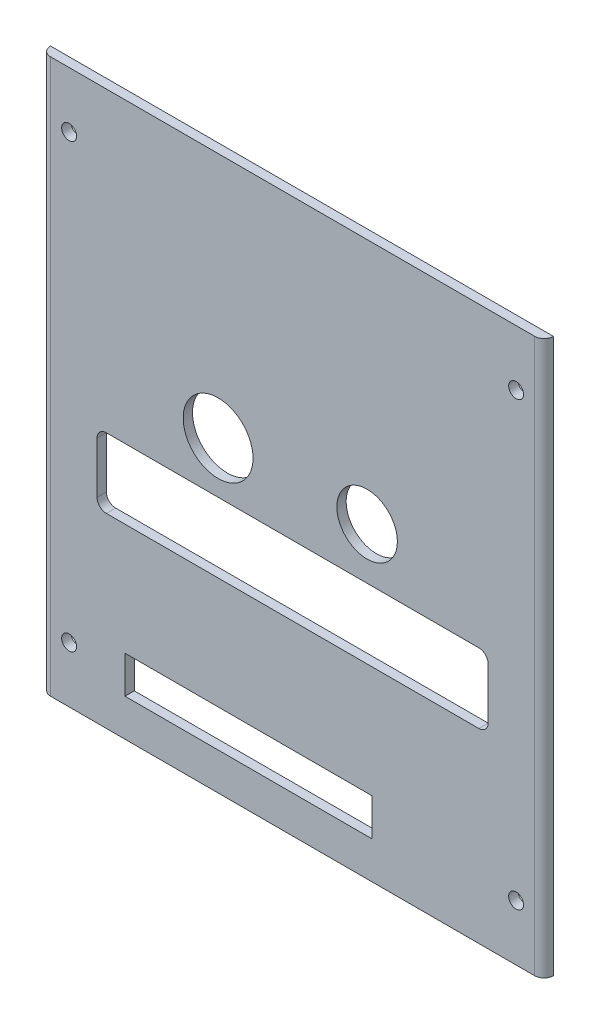
from build123d import *

# Parameters (mm, degrees)
SZKIC1_W                    = 104
SZKIC1_H                    = 118.94
DODANIE_WYCI_GNI_CIE1_DEPTH = 2
SZKIC2_W                    = 53
SZKIC2_H                    = 1.6
SZKIC2_H_2                  = 6.407346329
WYTNIJ_WYCI_GNI_CIE2_DEPTH  = 2
SZKIC4_W                    = 2
SZKIC4_H                    = 118.94
DODANIE_WYCI_GNI_CIE2_DEPTH = 2
SZKIC5_R                    = 1.6
WYTNIJ_WYCI_GNI_CIE3_DEPTH  = 2
ZAOKR_GLENIE1_R             = 2
SZKIC6_R                    = 6.5
SZKIC6_R_2                  = 7.5
WYTNIJ_WYCI_GNI_CIE4_DEPTH  = 12
WYTNIJ_WYCI_GNI_CIE5_DEPTH  = 12
ZAOKR_GLENIE2_R             = 2


with BuildPart() as part:
    # Szkic1 → Dodanie-wyciągnięcie1 (new body)
    with BuildSketch(Plane.XY):
        with Locations((56, 59.47)):
            Rectangle(SZKIC1_W, SZKIC1_H)
    extrude(amount=DODANIE_WYCI_GNI_CIE1_DEPTH)

    # Szkic2 → Wytnij-wyciągnięcie2 (cut)
    with BuildSketch(Plane(origin=(0, 0, 0), x_dir=(-1, 0, 0), z_dir=(0, 0, -1))):
        with Locations((-46.5, 8.8)):
            Rectangle(SZKIC2_W, SZKIC2_H)
        with Locations((-46.5, 12.803673165)):
            Rectangle(SZKIC2_W, SZKIC2_H_2)
    extrude(amount=-WYTNIJ_WYCI_GNI_CIE2_DEPTH, mode=Mode.SUBTRACT)

    # Szkic4 → Dodanie-wyciągnięcie2 (add)
    with BuildSketch(Plane(origin=(0, 0, 0), x_dir=(-1, 0, 0), z_dir=(0, 0, -1))):
        with Locations((-3, 59.47)):
            Rectangle(SZKIC4_W, SZKIC4_H)
        with Locations((-109, 59.47)):
            Rectangle(SZKIC4_W, SZKIC4_H)
    extrude(amount=-DODANIE_WYCI_GNI_CIE2_DEPTH)

    # Szkic5 → Wytnij-wyciągnięcie3 (cut)
    with BuildSketch(Plane.XY.offset(2)):
        with Locations((8, 12)):
            Circle(SZKIC5_R)
        with Locations((104, 12)):
            Circle(SZKIC5_R)
        with Locations((8, 106.94)):
            Circle(SZKIC5_R)
        with Locations((104, 106.94)):
            Circle(SZKIC5_R)
    extrude(amount=-WYTNIJ_WYCI_GNI_CIE3_DEPTH, mode=Mode.SUBTRACT)

    # Zaokrąglenie1
    zaokr_glenie1_edges = [part.edges().sort_by_distance(p)[0] for p in [
        (110, 59.47, 2),
        (2, 59.47, 2),
    ]]
    fillet(zaokr_glenie1_edges, radius=ZAOKR_GLENIE1_R - 0.0001)  # a hair under: the kernel refuses the full size

    # Szkic6 → Wytnij-wyciągnięcie4 (cut)
    with BuildSketch(Plane.XY.offset(2)):
        with Locations((72, 66)):
            Circle(SZKIC6_R)
        with Locations((40, 66)):
            Circle(SZKIC6_R_2)
    extrude(amount=-WYTNIJ_WYCI_GNI_CIE4_DEPTH, mode=Mode.SUBTRACT)

    # Szkic7 → Wytnij-wyciągnięcie5 (cut)
    with BuildSketch(Plane.XY.offset(2)):
        Polygon((56, 55), (98, 55), (98, 40), (14, 40), (14, 55), align=None)
    extrude(amount=-WYTNIJ_WYCI_GNI_CIE5_DEPTH, mode=Mode.SUBTRACT)

    # Zaokrąglenie2
    zaokr_glenie2_edges = [part.edges().sort_by_distance(p)[0] for p in [
        (14, 55, 1),
        (98, 55, 1),
        (98, 40, 1),
        (14, 40, 1),
    ]]
    fillet(zaokr_glenie2_edges, radius=ZAOKR_GLENIE2_R)


solid = part.part
